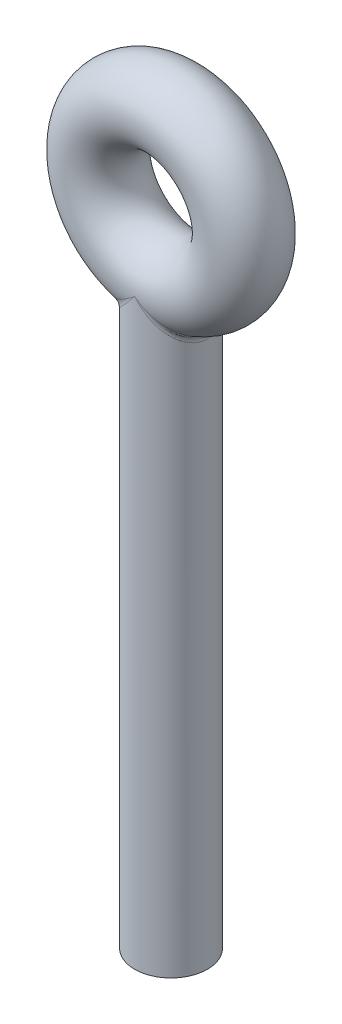
from build123d import *

# Parameters (mm, degrees)
SKETCH2_R           = 9.525
SKETCH3_R           = 9.525
BOSS_EXTRUDE1_DEPTH = 152.4
FILLET1_R           = 2.54


with BuildPart() as part:
    # Sketch2 → Revolve1 (revolve)
    with BuildSketch(Plane(origin=(0, 0, 0), x_dir=(0, 0, -1), z_dir=(1, 0, 0))):
        with Locations((0, 19.05)):
            Circle(SKETCH2_R)
    revolve(axis=Axis((0, 0, -88.99), (0, 0, 1)))

    # Sketch3 → Boss-Extrude1 (add)
    with BuildSketch(Plane(origin=(0, -19.05, 0), x_dir=(-1, 0, 0), z_dir=(0, 1, 0))):
        Circle(SKETCH3_R)
    extrude(amount=-BOSS_EXTRUDE1_DEPTH)

    # Fillet1
    fillet1_edges = [part.edges().sort_by_distance(p)[0] for p in [
        (9.524999999, -26.940768363, -0.000120478),
    ]]
    fillet(fillet1_edges, radius=FILLET1_R)
    fillet1_2_edges = [part.edges().sort_by_distance(p)[0] for p in [
        (-5.874869371, -24.222613877, 7.497435224),
        (-5.874876382, -24.222619391, -7.497429729),
    ]]
    fillet(fillet1_2_edges, radius=FILLET1_R)


solid = part.part
